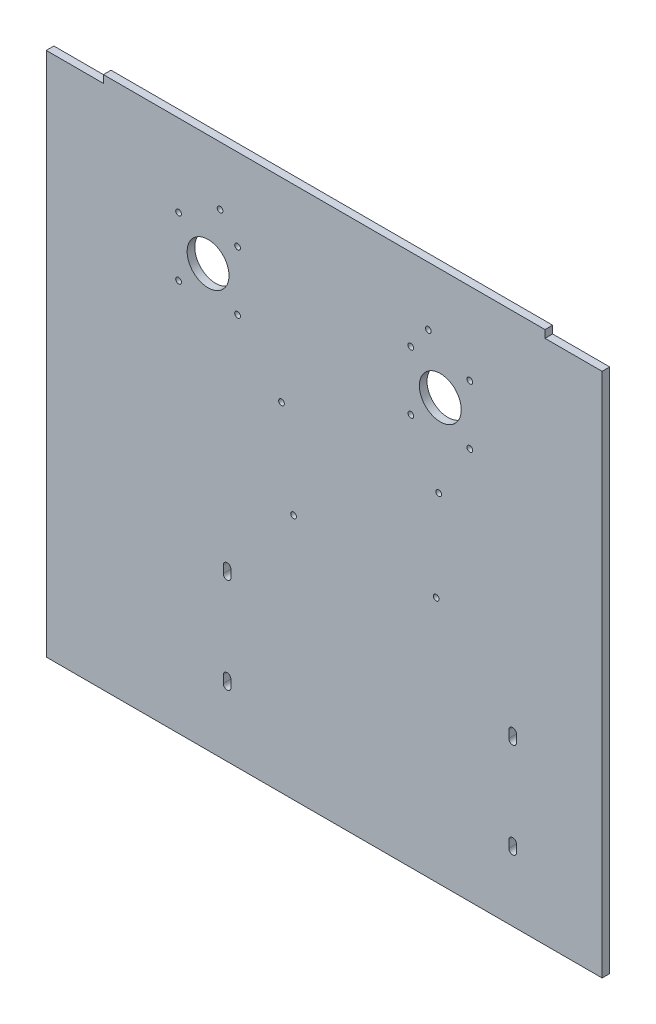
from build123d import *

# Parameters (mm, degrees)
SKETCH1_R           = 1.5
SKETCH1_R_2         = 11
BOSS_EXTRUDE1_DEPTH = 4


with BuildPart() as part:
    # Sketch1 → Boss-Extrude1 (new body)
    with BuildSketch(Plane.XY):
        Polygon((-146, -123.5), (146, -123.5), (146, 152.5), (116, 152.5), (116, 156.5), (-116, 156.5), (-116, 152.5), (-146, 152.5), align=None)
        with BuildLine():
            ThreePointArc((-49, -89), (-51, -91), (-53, -89))
            Line((-53, -89), (-53, -85.07834269))
            ThreePointArc((-53, -85.07834269), (-51, -83.07834269), (-49, -85.07834269))
            Line((-49, -85.07834269), (-49, -89))
        make_face(mode=Mode.SUBTRACT)
        with BuildLine():
            ThreePointArc((-49, -39), (-51, -41), (-53, -39))
            Line((-53, -39), (-53, -35.07834269))
            ThreePointArc((-53, -35.07834269), (-51, -33.07834269), (-49, -35.07834269))
            Line((-49, -35.07834269), (-49, -39))
        make_face(mode=Mode.SUBTRACT)
        with Locations((-16.078681203, 5.935129713)):
            Circle(SKETCH1_R, mode=Mode.SUBTRACT)
        with BuildLine():
            ThreePointArc((101, -89), (99, -91), (97, -89))
            Line((97, -89), (97, -85.07834269))
            ThreePointArc((97, -85.07834269), (99, -83.07834269), (101, -85.07834269))
            Line((101, -85.07834269), (101, -89))
        make_face(mode=Mode.SUBTRACT)
        with Locations((58.851318797, 5.935129713)):
            Circle(SKETCH1_R, mode=Mode.SUBTRACT)
        with BuildLine():
            ThreePointArc((101, -39), (99, -41), (97, -39))
            Line((97, -39), (97, -35.07834269))
            ThreePointArc((97, -35.07834269), (99, -33.07834269), (101, -35.07834269))
            Line((101, -35.07834269), (101, -39))
        make_face(mode=Mode.SUBTRACT)
        with Locations((-76.5, 82.5)):
            Circle(SKETCH1_R, mode=Mode.SUBTRACT)
        with Locations((-45.5, 82.5)):
            Circle(SKETCH1_R, mode=Mode.SUBTRACT)
        with Locations((-22.428681203, 54.195129713)):
            Circle(SKETCH1_R, mode=Mode.SUBTRACT)
        with Locations((-76.5, 113.5)):
            Circle(SKETCH1_R, mode=Mode.SUBTRACT)
        with Locations((-61, 98)):
            Circle(SKETCH1_R_2, mode=Mode.SUBTRACT)
        with Locations((-45.5, 113.5)):
            Circle(SKETCH1_R, mode=Mode.SUBTRACT)
        with Locations((60.121318797, 54.195129713)):
            Circle(SKETCH1_R, mode=Mode.SUBTRACT)
        with Locations((45.5, 82.5)):
            Circle(SKETCH1_R, mode=Mode.SUBTRACT)
        with Locations((76.5, 82.5)):
            Circle(SKETCH1_R, mode=Mode.SUBTRACT)
        with Locations((61, 98)):
            Circle(SKETCH1_R_2, mode=Mode.SUBTRACT)
        with Locations((45.5, 113.5)):
            Circle(SKETCH1_R, mode=Mode.SUBTRACT)
        with Locations((76.5, 113.5)):
            Circle(SKETCH1_R, mode=Mode.SUBTRACT)
        with Locations((54.7, 125.75)):
            Circle(SKETCH1_R, mode=Mode.SUBTRACT)
        with Locations((-54.7, 125.75)):
            Circle(SKETCH1_R, mode=Mode.SUBTRACT)
    extrude(amount=BOSS_EXTRUDE1_DEPTH)


solid = part.part
